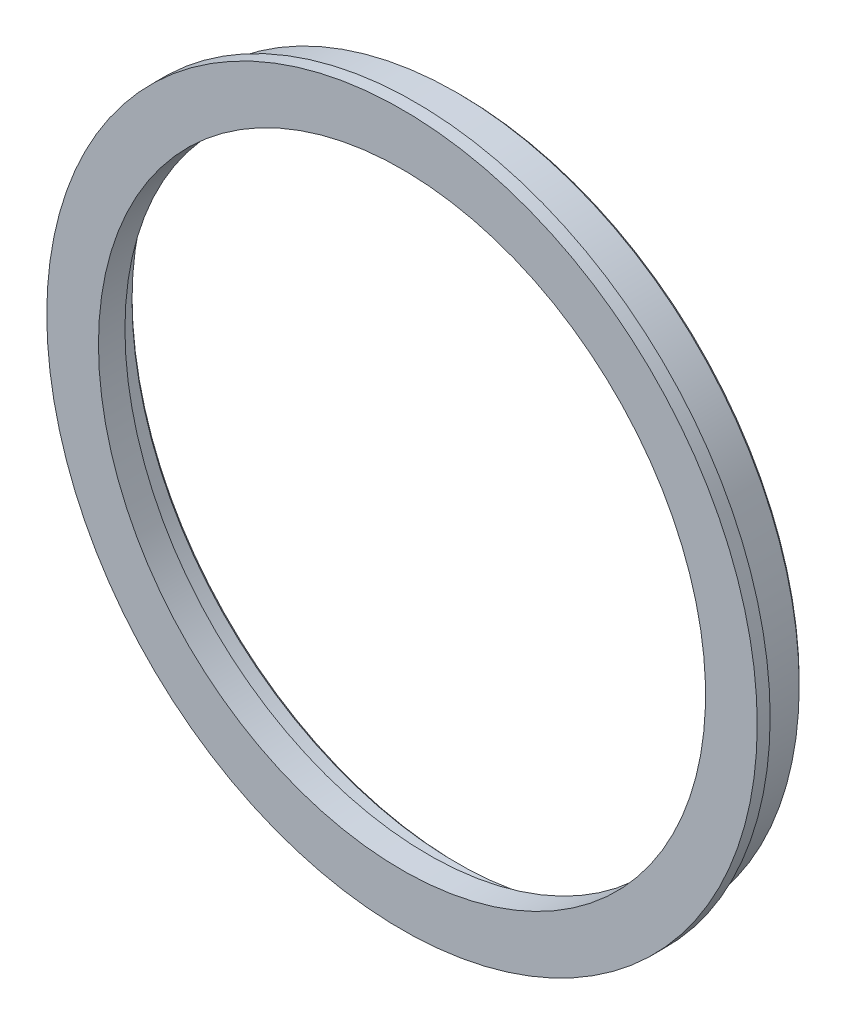
from build123d import *

# Parameters (mm, degrees)
CHAMFER1_SIZE           = 0.5
CUT_EXTRUDE1_DEPTH      = 81.068720484
CUT_EXTRUDE1_DEPTH_BACK = 81.068720484
SKETCH2_W               = 110.89778328
SKETCH2_H               = 14.994305345


with BuildPart() as part:
    # Sketch1 → Revolve1 (revolve)
    with BuildSketch(Plane(origin=(0, 0, 0), x_dir=(1, 0, 0), z_dir=(0, 1, 0)), mode=Mode.PRIVATE) as revolve1_sk:
        Polygon((50.3, 19), (50.3, 14.1), (47, 14.1), (47, 0), (49, 0), (49, 2.5), (48, 2.5), (48, 7.5), (49, 7.5), (49, 10), (55, 10), (55, 12), (53, 12), (53, 19), align=None)
    revolve(revolve1_sk.sketch.rotate(Axis((0, 0, -69.169847328), (0, 0, 1)), 180), axis=Axis((0, 0, -69.169847328), (0, 0, 1)))

    # Chamfer1
    chamfer1_edges = [part.edges().sort_by_distance(p)[0] for p in [
        (49, 0, -10),
        (49, 0, -7.5),
        (48, 0, -7.5),
        (48, 0, -2.5),
        (49, 0, -2.5),
        (49, 0, 0),
        (50.3, 0, -19),
        (53, 0, -19),
    ]]
    chamfer(chamfer1_edges, length=CHAMFER1_SIZE - 0.0001)  # a hair under: the kernel refuses the full size

    # Sketch2 → Cut-Extrude1 (cut, two sides: drawn at the far end of the back side and taken through both)
    with BuildSketch(Plane(origin=(0, 0, 0), x_dir=(1, 0, 0), z_dir=(0, 1, 0)).offset(-CUT_EXTRUDE1_DEPTH_BACK)):
        with Locations((0.44889164, 2.502847328)):
            Rectangle(SKETCH2_W, SKETCH2_H)
    extrude(amount=CUT_EXTRUDE1_DEPTH + CUT_EXTRUDE1_DEPTH_BACK, mode=Mode.SUBTRACT)


solid = part.part
